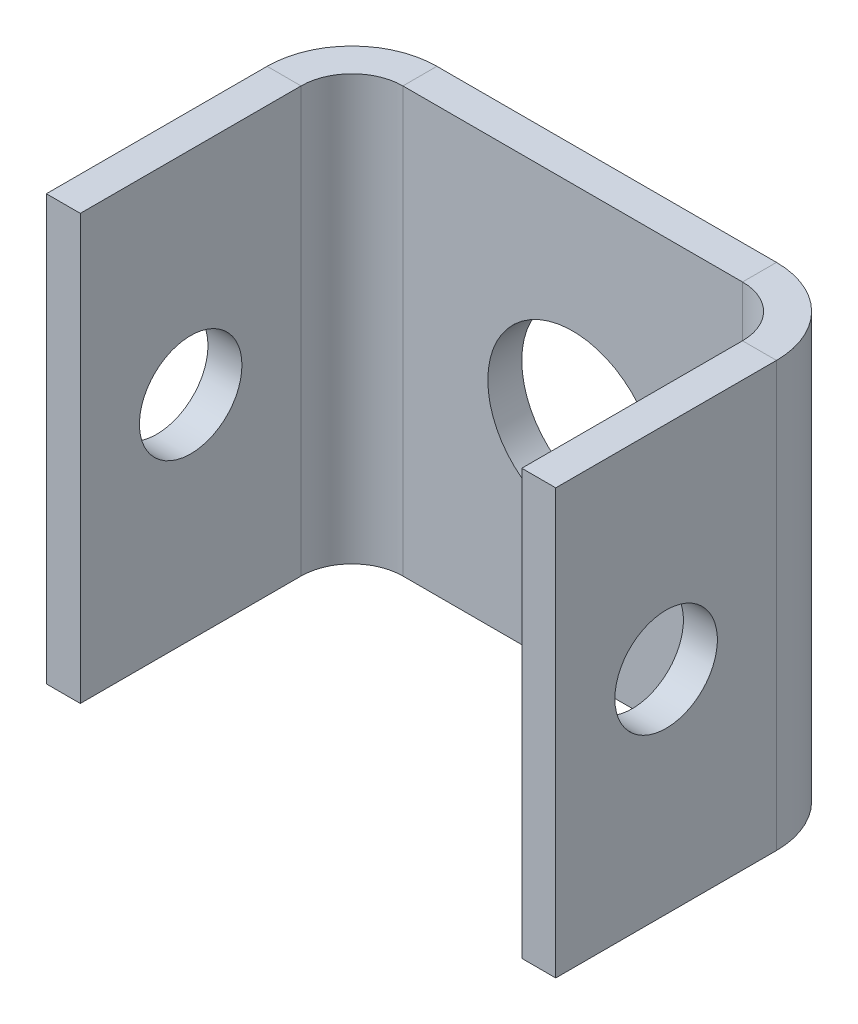
from build123d import *

# Parameters (mm, degrees)
BASE_FLANGE2_DEPTH      = 12.5
CUT_EXTRUDE2_DEPTH      = 38.151715977
CUT_EXTRUDE2_DEPTH_BACK = 38.151715977
SKETCH11_R              = 3.018390671
CUT_EXTRUDE3_REACH      = 28.557
SKETCH13_R              = 5


# Sheet-metal steps are written as plain solids
with BuildPart() as part:
    # Sketch2 → Base-Flange2 (new, symmetric)
    with BuildSketch(Plane(origin=(0, 0, 0), x_dir=(1, 0, 0), z_dir=(0, 1, 0))):
        with BuildLine():
            Line((-15, 0), (-15, 13))
            ThreePointArc((-15, 13), (-13.535533906, 16.535533906), (-10, 18))
            Line((-10, 18), (10, 18))
            ThreePointArc((10, 18), (13.535533906, 16.535533906), (15, 13))
            Line((15, 13), (15, 0))
            Line((15, 0), (13, 0))
            Line((13, 0), (13, 13))
            ThreePointArc((13, 13), (12.121320344, 15.121320344), (10, 16))
            Line((10, 16), (-10, 16))
            ThreePointArc((-10, 16), (-12.121320344, 15.121320344), (-13, 13))
            Line((-13, 13), (-13, 0))
            Line((-13, 0), (-15, 0))
        make_face()
    extrude(amount=BASE_FLANGE2_DEPTH, both=True)

    # Sketch11 → Cut-Extrude2 (cut, two sides: drawn at the far end of the back side and taken through both)
    with BuildSketch(Plane(origin=(15, 0, 0), x_dir=(0, 0, -1), z_dir=(1, 0, 0)).offset(-CUT_EXTRUDE2_DEPTH_BACK)):
        with Locations(Location((6.5, 0, 0), (0, 0, 180))):
            Circle(SKETCH11_R)
    extrude(amount=CUT_EXTRUDE2_DEPTH + CUT_EXTRUDE2_DEPTH_BACK, mode=Mode.SUBTRACT)

    # Sketch13 → Cut-Extrude3 (cut, up to next)
    with BuildSketch(Plane(origin=(0, 0, -18), x_dir=(-1, 0, 0), z_dir=(0, 0, -1)), mode=Mode.PRIVATE) as cut_extrude3_sk1:
        Circle(SKETCH13_R)
    cut_extrude3_tool1 = extrude(cut_extrude3_sk1.sketch, amount=-CUT_EXTRUDE3_REACH, mode=Mode.PRIVATE) & part.part
    add(cut_extrude3_tool1.solids().sort_by_distance((0, 0, -18))[0], mode=Mode.SUBTRACT)


solid = part.part
